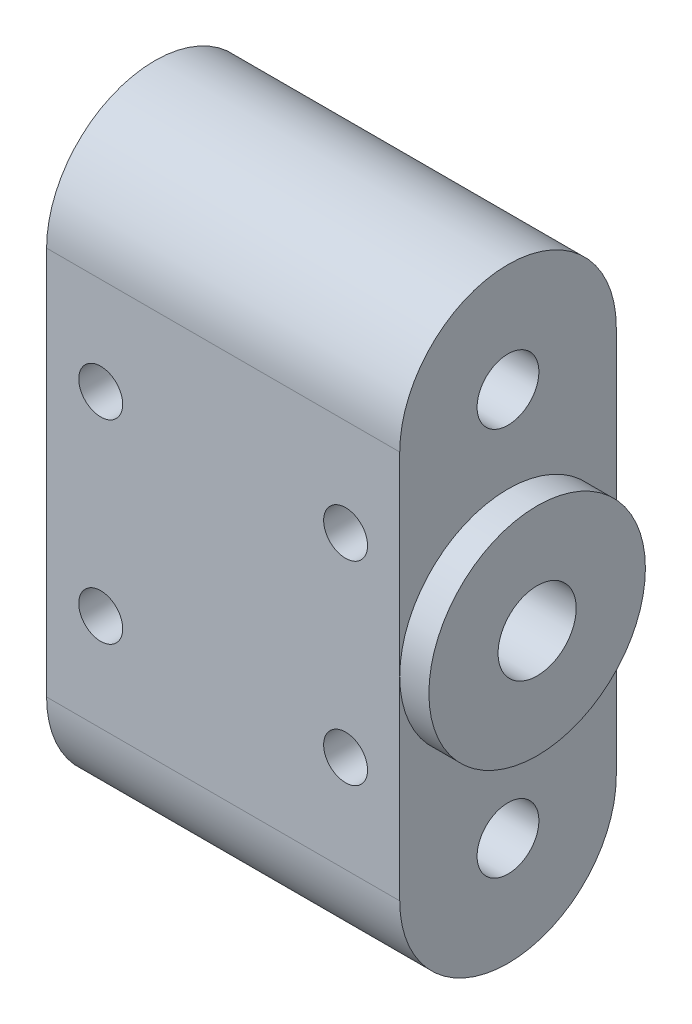
from build123d import *

# Parameters (mm, degrees)
BOSS_EXTRUDE1_DEPTH     = 23.075011
SKETCH8_R               = 7.0739
BOSS_EXTRUDE2_DEPTH     = 1.905
F_1_4_20_TAPPED_HOLE1_D = 5.1054
F_10_32_TAPPED_HOLE1_D  = 4.0386
F_6_40_TAPPED_HOLE1_D   = 2.8702


with BuildPart() as part:
    # Sketch1 → Boss-Extrude1 (new body)
    with BuildSketch(Plane(origin=(0, 0, 0), x_dir=(0, 0, -1), z_dir=(1, 0, 0))):
        with BuildLine():
            Line((7.0739, 12.7), (7.0739, -12.7))
            ThreePointArc((7.0739, -12.7), (0, -19.7739), (-7.0739, -12.7))
            Line((-7.0739, -12.7), (-7.0739, 12.7))
            ThreePointArc((-7.0739, 12.7), (0, 19.7739), (7.0739, 12.7))
        make_face()
    extrude(amount=BOSS_EXTRUDE1_DEPTH)

    # Sketch8 → Boss-Extrude2 (add)
    with BuildSketch(Plane(origin=(23.075011, 0, 0), x_dir=(0, 0, -1), z_dir=(1, 0, 0))):
        Circle(SKETCH8_R)
    extrude(amount=BOSS_EXTRUDE2_DEPTH)

    # 1/4-20 Tapped Hole1 (through all)
    with Locations(Plane(origin=(24.980011, 0, 0), x_dir=(0, 0, -1), z_dir=(1, 0, 0))):
        with Locations((0, 0)):
            Hole(F_1_4_20_TAPPED_HOLE1_D / 2)

    # #10-32 Tapped Hole1 (through all)
    with Locations(Plane(origin=(23.075011, 0, 0), x_dir=(0, 0, -1), z_dir=(1, 0, 0))):
        with Locations((0, 12.7), (0, -12.7)):
            Hole(F_10_32_TAPPED_HOLE1_D / 2)

    # #6-40 Tapped Hole1 (through all)
    with Locations(Plane.XY.offset(7.0739)):
        with Locations((3.5375055, 6.35), (19.5375055, 6.35), (3.5375055, -6.35), (19.5375055, -6.35)):
            Hole(F_6_40_TAPPED_HOLE1_D / 2)


solid = part.part
